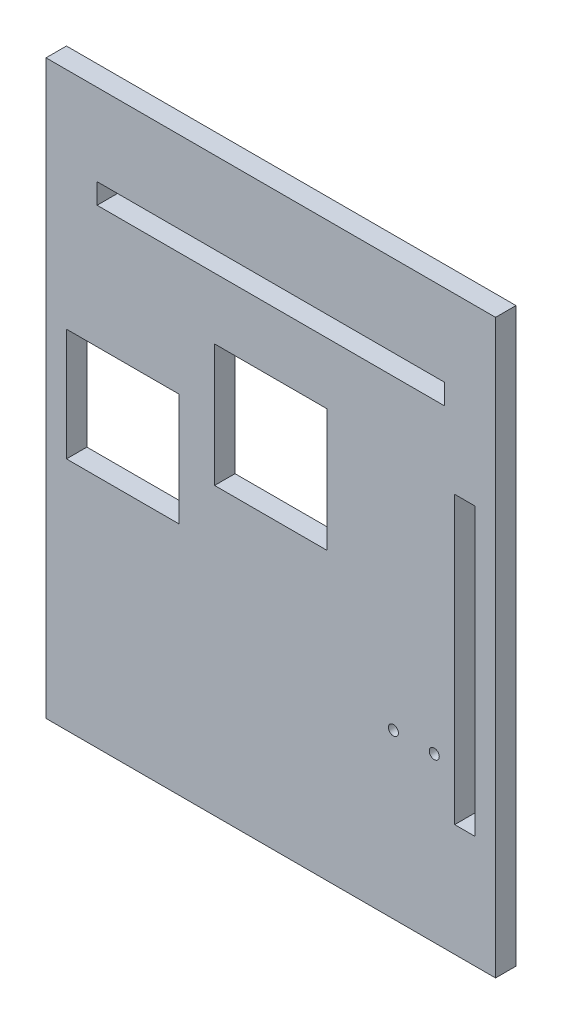
from build123d import *

# Parameters (mm, degrees)
ESQUISSE1_W                  = 220
ESQUISSE1_H                  = 280
BOSS_EXTRU_1_DEPTH           = 10
ESQUISSE2_R                  = 2
ENL_V_MAT_EXTRU_1_DEPTH      = 10
ENL_V_MAT_EXTRU_2_DEPTH      = 357.230262611
ENL_V_MAT_EXTRU_2_DEPTH_BACK = 357.230262611
ESQUISSE3_W                  = 55
ESQUISSE3_H                  = 60
ESQUISSE3_H_2                = 55
ESQUISSE3_W_2                = 10
ESQUISSE3_H_3                = 140
ENL_V_MAT_EXTRU_3_DEPTH      = 357.230262611
ENL_V_MAT_EXTRU_3_DEPTH_BACK = 357.230262611
ESQUISSE5_W                  = 170
ESQUISSE5_H                  = 10
ENL_V_MAT_EXTRU_4_DEPTH      = 357.230262611
ENL_V_MAT_EXTRU_4_DEPTH_BACK = 357.230262611
ESQUISSE6_R                  = 2.45


with BuildPart() as part:
    # Esquisse1 → Boss.-Extru.1 (new body)
    with BuildSketch(Plane.XY):
        with Locations((110, 140)):
            Rectangle(ESQUISSE1_W, ESQUISSE1_H)
    extrude(amount=BOSS_EXTRU_1_DEPTH)

    # Esquisse2 → Enlèv. mat.-Extru.1 (cut)
    with BuildSketch(Plane.XZ):
        with Locations((110, 5)):
            Circle(ESQUISSE2_R)
        with Locations((210, 5)):
            Circle(ESQUISSE2_R)
        with Locations((10, 5)):
            Circle(ESQUISSE2_R)
    extrude(amount=-ENL_V_MAT_EXTRU_1_DEPTH, mode=Mode.SUBTRACT)

    # Esquisse3 → Enlèv. mat.-Extru.2 (cut, two sides: drawn at the far end of the back side and taken through both)
    with BuildSketch(Plane.XY.offset(10).offset(-ENL_V_MAT_EXTRU_2_DEPTH_BACK)):
        with Locations((110, 170)):
            Rectangle(ESQUISSE3_W, ESQUISSE3_H)
        with Locations((37.5, 142.5)):
            Rectangle(ESQUISSE3_W, ESQUISSE3_H_2)
        with Locations((205, 125)):
            Rectangle(ESQUISSE3_W_2, ESQUISSE3_H_3)
    extrude(amount=ENL_V_MAT_EXTRU_2_DEPTH + ENL_V_MAT_EXTRU_2_DEPTH_BACK, mode=Mode.SUBTRACT)

    # Esquisse5 → Enlèv. mat.-Extru.3 (cut, two sides: drawn at the far end of the back side and taken through both)
    with BuildSketch(Plane.XY.offset(10).offset(-ENL_V_MAT_EXTRU_3_DEPTH_BACK)):
        with Locations((110, 235)):
            Rectangle(ESQUISSE5_W, ESQUISSE5_H)
    extrude(amount=ENL_V_MAT_EXTRU_3_DEPTH + ENL_V_MAT_EXTRU_3_DEPTH_BACK, mode=Mode.SUBTRACT)

    # Esquisse6 → Enlèv. mat.-Extru.4 (cut, two sides: drawn at the far end of the back side and taken through both)
    with BuildSketch(Plane.XY.offset(10).offset(-ENL_V_MAT_EXTRU_4_DEPTH_BACK)):
        with Locations((190, 80)):
            Circle(ESQUISSE6_R)
        with Locations((170, 80)):
            Circle(ESQUISSE6_R)
    extrude(amount=ENL_V_MAT_EXTRU_4_DEPTH + ENL_V_MAT_EXTRU_4_DEPTH_BACK, mode=Mode.SUBTRACT)


solid = part.part
